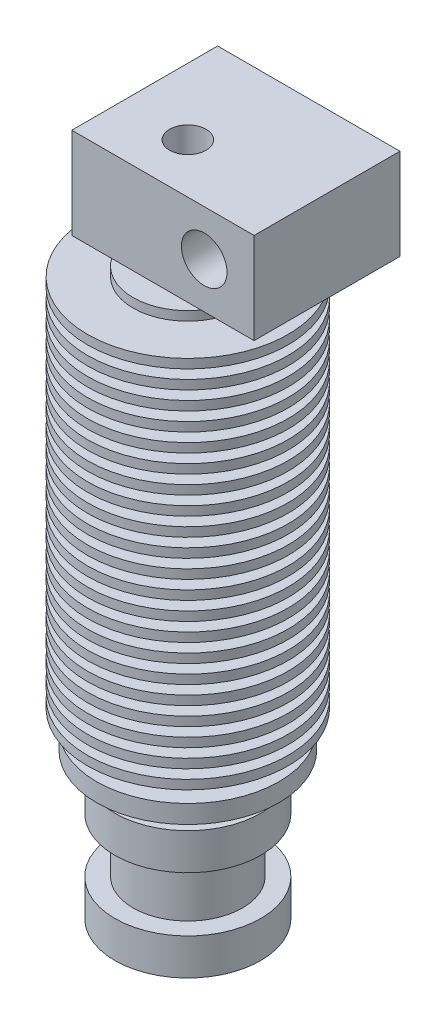
from build123d import *

# Parameters (mm, degrees)
SKETCH1_R            = 8
SKETCH1_R_2          = 3
BOSS_EXTRUDE1_DEPTH  = 4
SKETCH2_R            = 6
SKETCH2_R_2          = 3
BOSS_EXTRUDE2_DEPTH  = 6
SKETCH3_R            = 8
SKETCH3_R_2          = 3
BOSS_EXTRUDE3_DEPTH  = 4
SKETCH4_R            = 6
BOSS_EXTRUDE4_DEPTH  = 2
SKETCH5_R            = 10
BOSS_EXTRUDE5_DEPTH  = 2
SKETCH6_R            = 6
BOSS_EXTRUDE6_DEPTH  = 2
SKETCH7_R            = 11
BOSS_EXTRUDE7_DEPTH  = 1
SKETCH8_R            = 6
BOSS_EXTRUDE8_DEPTH  = 1
LPATTERN2_COUNT      = 22
LPATTERN2_PITCH      = 2
SKETCH9_R            = 2
CUT_EXTRUDE1_DEPTH   = 5000
SKETCH10_R           = 3
SKETCH10_R_2         = 2
BOSS_EXTRUDE9_DEPTH  = 2
SKETCH11_W           = 20
SKETCH11_H           = 16
SKETCH11_R           = 2
BOSS_EXTRUDE10_DEPTH = 10
SKETCH12_R           = 2.5
CUT_EXTRUDE2_DEPTH   = 31


# Read off the part's stored shape, not the designer's step: LPattern3
with BuildPart() as part:
    # Sketch1 → Boss-Extrude1 (new body)
    with BuildSketch(Plane(origin=(0, 0, 0), x_dir=(1, 0, 0), z_dir=(0, 1, 0))):
        with Locations(Location((0, 0, 0), (0, 0, 270))):
            Circle(SKETCH1_R)
        with Locations(Location((0, 0, 0), (0, 0, 270))):
            Circle(SKETCH1_R_2, mode=Mode.SUBTRACT)
    extrude(amount=BOSS_EXTRUDE1_DEPTH)

    # Sketch2 → Boss-Extrude2 (add)
    with BuildSketch(Plane(origin=(0, 4, 0), x_dir=(1, 0, 0), z_dir=(0, 1, 0))):
        with Locations(Location((0, 0, 0), (0, 0, 270))):
            Circle(SKETCH2_R)
        with Locations(Location((0, 0, 0), (0, 0, 270))):
            Circle(SKETCH2_R_2, mode=Mode.SUBTRACT)
    extrude(amount=BOSS_EXTRUDE2_DEPTH)

    # Sketch3 → Boss-Extrude3 (add)
    with BuildSketch(Plane(origin=(0, 10, 0), x_dir=(1, 0, 0), z_dir=(0, 1, 0))):
        with Locations(Location((0, 0, 0), (0, 0, 270))):
            Circle(SKETCH3_R)
        with Locations(Location((0, 0, 0), (0, 0, 270))):
            Circle(SKETCH3_R_2, mode=Mode.SUBTRACT)
    extrude(amount=BOSS_EXTRUDE3_DEPTH)

    # Sketch4 → Boss-Extrude4 (add)
    with BuildSketch(Plane(origin=(0, 14, 0), x_dir=(1, 0, 0), z_dir=(0, 1, 0))):
        with Locations(Location((0, 0, 0), (0, 0, 270))):
            Circle(SKETCH4_R)
    extrude(amount=BOSS_EXTRUDE4_DEPTH)

    # Sketch5 → Boss-Extrude5 (add)
    with BuildSketch(Plane(origin=(0, 16, 0), x_dir=(1, 0, 0), z_dir=(0, 1, 0))):
        with Locations(Location((0, 0, 0), (0, 0, 270))):
            Circle(SKETCH5_R)
    extrude(amount=BOSS_EXTRUDE5_DEPTH)

    # Sketch6 → Boss-Extrude6 (add)
    with BuildSketch(Plane(origin=(0, 18, 0), x_dir=(1, 0, 0), z_dir=(0, 1, 0))):
        with Locations(Location((0, 0, 0), (0, 0, 270))):
            Circle(SKETCH6_R)
    extrude(amount=BOSS_EXTRUDE6_DEPTH)

    # Sketch7 → Boss-Extrude7 (add)
    with BuildSketch(Plane(origin=(0, 20, 0), x_dir=(1, 0, 0), z_dir=(0, 1, 0))):
        with Locations(Location((0, 0, 0), (0, 0, 270))):
            Circle(SKETCH7_R)
    boss_extrude7 = extrude(amount=BOSS_EXTRUDE7_DEPTH)

    # Sketch8 → Boss-Extrude8 (add)
    with BuildSketch(Plane(origin=(0, 21, 0), x_dir=(1, 0, 0), z_dir=(0, 1, 0))):
        with Locations(Location((0, 0, 0), (0, 0, 270))):
            Circle(SKETCH8_R)
    boss_extrude8 = extrude(amount=BOSS_EXTRUDE8_DEPTH)

    # LPattern2: Boss-Extrude7, Boss-Extrude8 ×22, 20 skipped
    with Locations(*[(0, i * LPATTERN2_PITCH, 0) for i in range(1, LPATTERN2_COUNT) if i not in (2, 3, 4, 5, 6, 7, 8, 9, 10, 11, 12, 13, 14, 15, 16, 17, 18, 19, 20, 21)]):
        add(boss_extrude7)
        add(boss_extrude8)

    # LPattern3 outline → LPattern3 (revolve)
    with BuildSketch(Plane.XY):
        Polygon((11, 27), (6, 27), (6, 28), (11, 28), (11, 29), (6, 29), (6, 30), (11, 30), (11, 31), (6, 31), (6, 32), (11, 32), (11, 33), (6, 33), (6, 34), (11, 34), (11, 35), (6, 35), (6, 36), (11, 36), (11, 37), (6, 37), (6, 38), (11, 38), (11, 39), (6, 39), (6, 40), (11, 40), (11, 41), (6, 41), (6, 42), (11, 42), (11, 43), (6, 43), (6, 44), (11, 44), (11, 45), (6, 45), (6, 46), (11, 46), (11, 47), (6, 47), (6, 48), (11, 48), (11, 49), (6, 49), (6, 50), (11, 50), (11, 51), (6, 51), (6, 52), (11, 52), (11, 53), (6, 53), (6, 54), (11, 54), (11, 55), (6, 55), (6, 56), (11, 56), (11, 57), (6, 57), (6, 58), (11, 58), (11, 59), (6, 59), (6, 60), (11, 60), (11, 61), (6, 61), (6, 62), (0, 62), (0, 24), (11, 24), (11, 25), (6, 25), (6, 26), (11, 26), align=None)
    revolve(axis=Axis((0, 0, 0), (0, 1, 0)))

    # Sketch9 → Cut-Extrude1 (cut)
    with BuildSketch(Plane(origin=(0, 62, 0), x_dir=(1, 0, 0), z_dir=(0, 1, 0))):
        with Locations(Location((0, 0, 0), (0, 0, 270))):
            Circle(SKETCH9_R)
    extrude(amount=-CUT_EXTRUDE1_DEPTH, mode=Mode.SUBTRACT)

    # Sketch10 → Boss-Extrude9 (add)
    with BuildSketch(Plane(origin=(0, 62, 0), x_dir=(1, 0, 0), z_dir=(0, 1, 0))):
        with Locations(Location((0, 0, 0), (0, 0, 270))):
            Circle(SKETCH10_R)
        with Locations(Location((0, 0, 0), (0, 0, 270))):
            Circle(SKETCH10_R_2, mode=Mode.SUBTRACT)
    extrude(amount=BOSS_EXTRUDE9_DEPTH)

    # Sketch11 → Boss-Extrude10 (add)
    with BuildSketch(Plane(origin=(0, 64, 0), x_dir=(1, 0, 0), z_dir=(0, 1, 0))):
        with Locations((2.726704239, 2.545028179)):
            Rectangle(SKETCH11_W, SKETCH11_H)
        with Locations(Location((0, 0, 0), (0, 0, 270))):
            Circle(SKETCH11_R, mode=Mode.SUBTRACT)
    extrude(amount=BOSS_EXTRUDE10_DEPTH)

    # Sketch12 → Cut-Extrude2 (cut)
    with BuildSketch(Plane.XY.offset(5.454971821)):
        with Locations((7.254461047, 69)):
            Circle(SKETCH12_R)
    extrude(amount=-CUT_EXTRUDE2_DEPTH, mode=Mode.SUBTRACT)


solid = part.part
